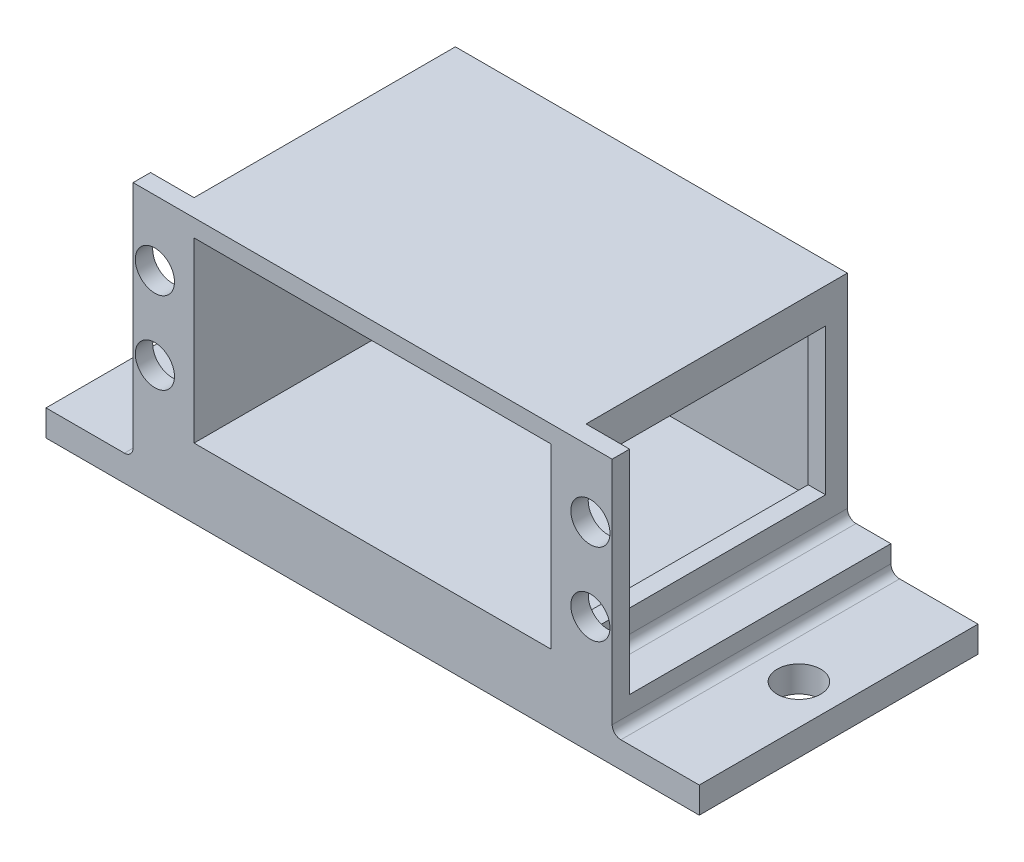
from build123d import *

# Parameters (mm, degrees)
SKETCH1_W               = 41
SKETCH1_H               = 30
BOSS_EXTRUDE1_DEPTH     = 20.4
SHELL1_T                = 2
BOSS_EXTRUDE2_START     = -2
BOSS_EXTRUDE2_OUTLINE_W = 5
BOSS_EXTRUDE2_OUTLINE_H = 20.4
BOSS_EXTRUDE2_OUTLINE_R = 2.25
BOSS_EXTRUDE2_DEPTH     = 2
SKETCH3_W               = 5
SKETCH3_H               = 2
BOSS_EXTRUDE3_DEPTH     = 2
SKETCH4_W               = 5
SKETCH4_H               = 2
BOSS_EXTRUDE4_DEPTH     = 2
SKETCH5_W               = 5
SKETCH5_H               = 2
BOSS_EXTRUDE5_DEPTH     = 2
SKETCH6_W               = 5
SKETCH6_H               = 2
BOSS_EXTRUDE6_DEPTH     = 2
SKETCH7_W               = 5
SKETCH7_H               = 30
BOSS_EXTRUDE7_DEPTH     = 1
SKETCH9_R               = 4.146052681
CUT_EXTRUDE4_DEPTH      = 11
SKETCH10_W              = 55
SKETCH10_H              = 32
BOSS_EXTRUDE9_DEPTH     = 2
BOSS_EXTRUDE10_DEPTH    = 3
FILLET1_R               = 1
SKETCH18_W              = 26.995153054
SKETCH18_H              = 16.789310936
CUT_EXTRUDE5_DEPTH      = 10
SKETCH20_R              = 2.5
CUT_EXTRUDE7_DEPTH      = 10


# Read off the part's stored shape, not the designer's step: Boss-Extrude2
with BuildPart() as part:
    # Sketch1 → Boss-Extrude1 (new body)
    with BuildSketch(Plane(origin=(0, 0, 0), x_dir=(1, 0, 0), z_dir=(0, 1, 0))):
        with Locations((20.5, 15)):
            Rectangle(SKETCH1_W, SKETCH1_H)
    extrude(amount=BOSS_EXTRUDE1_DEPTH)

    # Shell1
    shell1_openings = [part.faces().sort_by_distance(p)[0] for p in [
        (20.5, 10.2, 0),
    ]]
    offset(amount=SHELL1_T, openings=shell1_openings, kind=Kind.INTERSECTION)

    # Boss-Extrude2 outline → Boss-Extrude2 (add)
    # profile 1 of 2: a face of its own
    with BuildSketch(Plane.XY.offset(BOSS_EXTRUDE2_START)):
        with Locations((-4.5, 10.2)):
            Rectangle(BOSS_EXTRUDE2_OUTLINE_W, BOSS_EXTRUDE2_OUTLINE_H)
        with Locations((-4.5, 5.5)):
            Circle(BOSS_EXTRUDE2_OUTLINE_R, mode=Mode.SUBTRACT)
        with Locations((-4.5, 14.9)):
            Circle(BOSS_EXTRUDE2_OUTLINE_R, mode=Mode.SUBTRACT)
    # profile 2 of 2: a face of its own
    with BuildSketch(Plane.XY.offset(BOSS_EXTRUDE2_START)):
        with Locations((45.5, 10.2)):
            Rectangle(BOSS_EXTRUDE2_OUTLINE_W, BOSS_EXTRUDE2_OUTLINE_H)
        with Locations((45.5, 5.5)):
            Circle(BOSS_EXTRUDE2_OUTLINE_R, mode=Mode.SUBTRACT)
        with Locations((45.5, 14.9)):
            Circle(BOSS_EXTRUDE2_OUTLINE_R, mode=Mode.SUBTRACT)
    extrude(amount=BOSS_EXTRUDE2_DEPTH)

    # Sketch3 → Boss-Extrude3 (add)
    with BuildSketch(Plane(origin=(0, 20.4, 0), x_dir=(1, 0, 0), z_dir=(0, 1, 0))):
        with Locations((-4.5, 1)):
            Rectangle(SKETCH3_W, SKETCH3_H)
    extrude(amount=BOSS_EXTRUDE3_DEPTH)

    # Sketch4 → Boss-Extrude4 (add)
    with BuildSketch(Plane.XZ):
        with Locations((-4.5, -1)):
            Rectangle(SKETCH4_W, SKETCH4_H)
    extrude(amount=BOSS_EXTRUDE4_DEPTH)

    # Sketch5 → Boss-Extrude5 (add)
    with BuildSketch(Plane(origin=(0, 20.4, 0), x_dir=(1, 0, 0), z_dir=(0, 1, 0))):
        with Locations((45.5, 1)):
            Rectangle(SKETCH5_W, SKETCH5_H)
    extrude(amount=BOSS_EXTRUDE5_DEPTH)

    # Sketch6 → Boss-Extrude6 (add)
    with BuildSketch(Plane.XZ):
        with Locations((45.5, -1)):
            Rectangle(SKETCH6_W, SKETCH6_H)
    extrude(amount=BOSS_EXTRUDE6_DEPTH)

    # Sketch7 → Boss-Extrude7 (add)
    with BuildSketch(Plane.XZ.offset(2)):
        Polygon((-7, -2), (-2, -2), (-2, -32), (43, -32), (43, -2), (48, -2), (48, 0), (-7, 0), align=None)
        with Locations((-4.5, -17)):
            Rectangle(SKETCH7_W, SKETCH7_H)
        with Locations((45.5, -17)):
            Rectangle(SKETCH7_W, SKETCH7_H)
    extrude(amount=BOSS_EXTRUDE7_DEPTH)

    # Sketch9 → Cut-Extrude4 (cut)
    with BuildSketch(Plane(origin=(0, 0, -2), x_dir=(-1, 0, 0), z_dir=(0, 0, -1))):
        with Locations((4.5, 5.5)):
            Circle(SKETCH9_R)
        with Locations((4.5, 14.9)):
            Circle(SKETCH9_R)
    cut_extrude4 = extrude(amount=CUT_EXTRUDE4_DEPTH, mode=Mode.SUBTRACT)

    # Mirror1: Cut-Extrude4 across plane
    add(cut_extrude4.mirror(Plane(origin=(20.5, 0, 0), x_dir=(0, 0, 1), z_dir=(1, 0, 0))), mode=Mode.SUBTRACT)

    # Sketch10 → Boss-Extrude9 (add)
    with BuildSketch(Plane.XZ.offset(3)):
        with Locations((20.5, -16)):
            Rectangle(SKETCH10_W, SKETCH10_H)
    extrude(amount=BOSS_EXTRUDE9_DEPTH)

    # Sketch11 → Boss-Extrude10 (add)
    with BuildSketch(Plane.XZ.offset(5)):
        Polygon((48, 0), (-7, 0), (-17, 0), (-17, -32), (-7, -32), (48, -32), (58, -32), (58, 0), align=None)
    extrude(amount=BOSS_EXTRUDE10_DEPTH)

    # Fillet1
    fillet1_edges = [part.edges().sort_by_distance(p)[0] for p in [
        (43, -2, -17),
        (-7, -5, -16),
        (48, -5, -16),
        (-2, -2, -17),
    ]]
    fillet(fillet1_edges, radius=FILLET1_R)

    # Sketch18 → Cut-Extrude5 (cut)
    with BuildSketch(Plane(origin=(43, 0, 0), x_dir=(0, 0, -1), z_dir=(1, 0, 0))):
        with Locations((16.002935908, 10.000980191)):
            Rectangle(SKETCH18_W, SKETCH18_H)
    extrude(amount=-CUT_EXTRUDE5_DEPTH, mode=Mode.SUBTRACT)

    # Sketch20 → Cut-Extrude7 (cut)
    with BuildSketch(Plane(origin=(0, 0, 0), x_dir=(1, 0, 0), z_dir=(0, 1, 0))):
        with Locations(Location((-12.442315246, 16, 0), (0, 0, 270))):
            Circle(SKETCH20_R)
        with Locations(Location((53.442315246, 16, 0), (0, 0, 270))):
            Circle(SKETCH20_R)
    extrude(amount=-CUT_EXTRUDE7_DEPTH, mode=Mode.SUBTRACT)


solid = part.part
